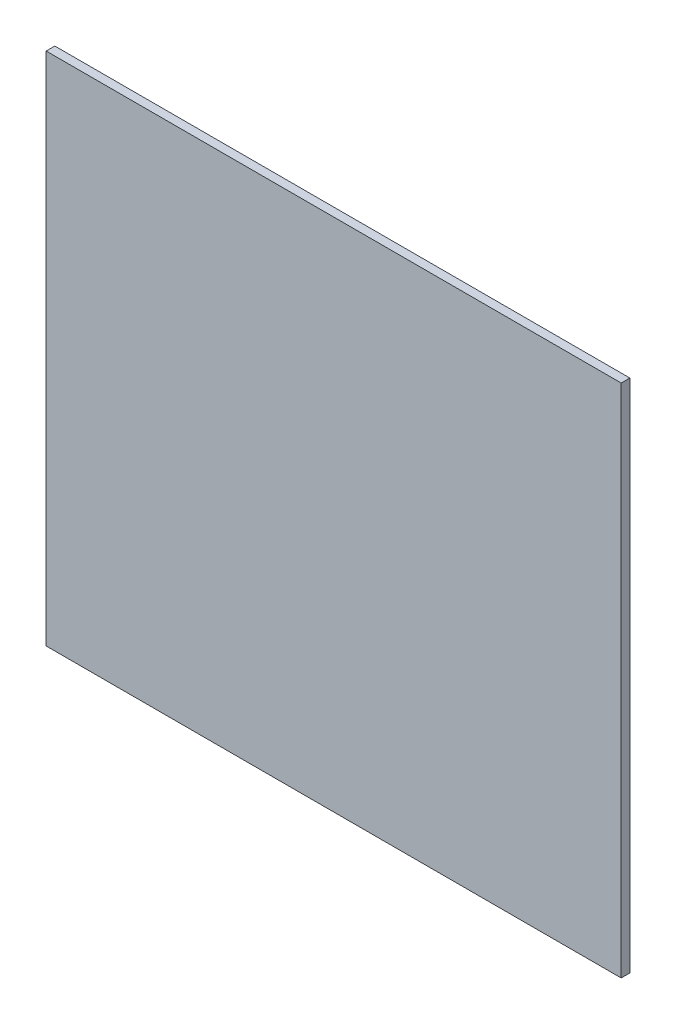
from build123d import *

# Parameters (mm, degrees)
ESQUISSE1_W        = 278.9
ESQUISSE1_H        = 249.9
BOSS_EXTRU_1_DEPTH = 4.2


with BuildPart() as part:
    # Esquisse1 → Boss.-Extru.1 (new body)
    with BuildSketch(Plane.XY):
        with Locations((90.319800378, 94.175135181)):
            Rectangle(ESQUISSE1_W, ESQUISSE1_H)
    extrude(amount=BOSS_EXTRU_1_DEPTH)


solid = part.part
